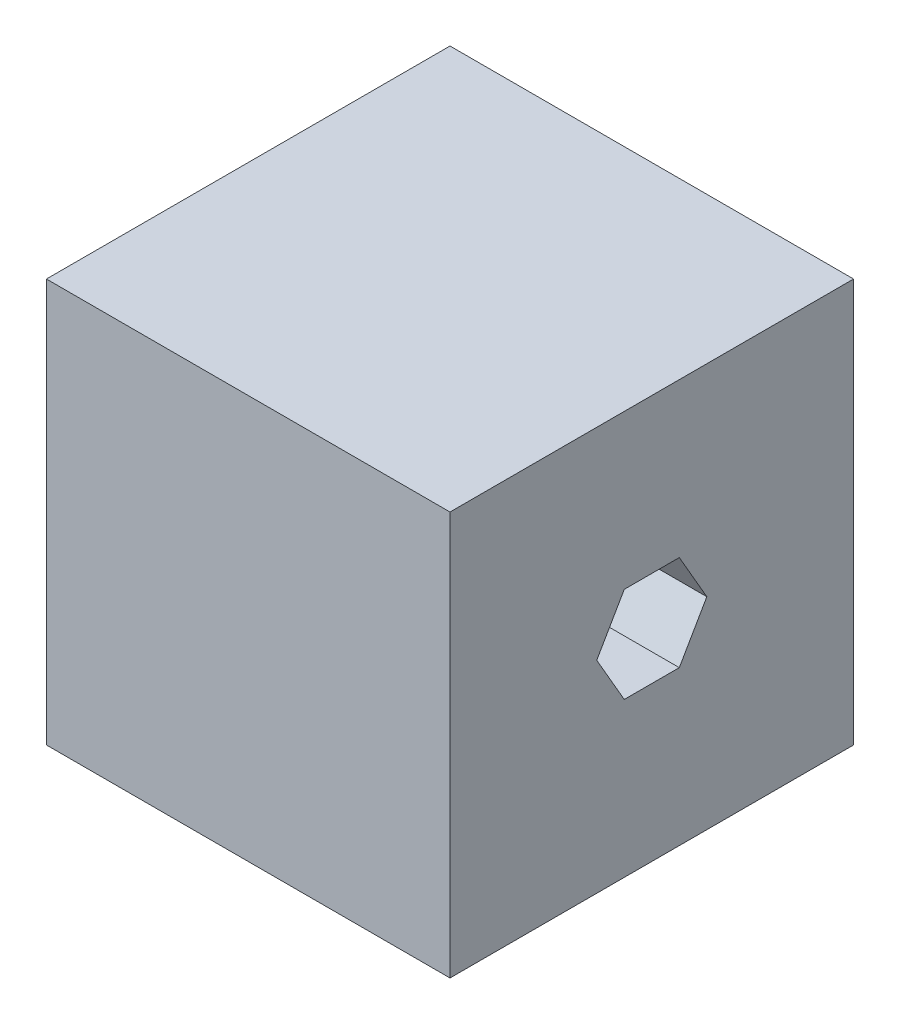
from build123d import *

# Parameters (mm, degrees)
SKETCH2_W           = 50.8
SKETCH2_H           = 50.8
BOSS_EXTRUDE1_DEPTH = 50.8
SKETCH3_W           = 25.4
SKETCH3_H           = 25.4
SKETCH3_W_2         = 22.352
SKETCH3_H_2         = 22.352
CUT_EXTRUDE1_DEPTH  = 15.24
CUT_EXTRUDE2_DEPTH  = 38.1


with BuildPart() as part:
    # Sketch2 → Boss-Extrude1 (new body)
    with BuildSketch(Plane(origin=(0, 0, 0), x_dir=(1, 0, 0), z_dir=(0, 1, 0))):
        Rectangle(SKETCH2_W, SKETCH2_H)
    extrude(amount=BOSS_EXTRUDE1_DEPTH)

    # Sketch3 → Cut-Extrude1 (cut)
    with BuildSketch(Plane.XZ):
        Rectangle(SKETCH3_W, SKETCH3_H)
        Rectangle(SKETCH3_W_2, SKETCH3_H_2, mode=Mode.SUBTRACT)
    extrude(amount=-CUT_EXTRUDE1_DEPTH, mode=Mode.SUBTRACT)

    # Sketch4 → Cut-Extrude2 (cut)
    with BuildSketch(Plane(origin=(25.4, 0, 0), x_dir=(0, 0, -1), z_dir=(1, 0, 0))):
        Polygon((6.92820323, 25.4), (3.464101615, 31.4), (-3.464101615, 31.4), (-6.92820323, 25.4), (-3.464101615, 19.4), (3.464101615, 19.4), align=None)
    extrude(amount=-CUT_EXTRUDE2_DEPTH, mode=Mode.SUBTRACT)


solid = part.part
